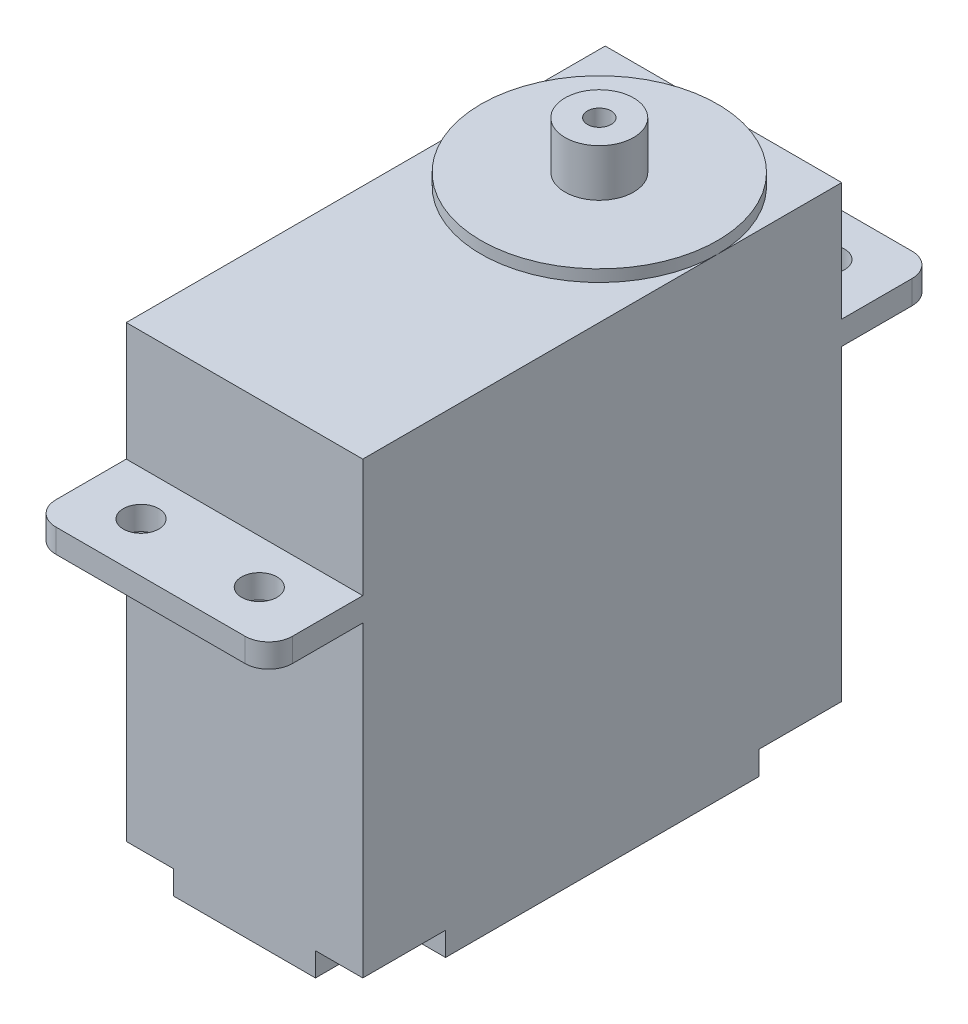
from build123d import *

# Parameters (mm, degrees)
SKETCH2_W           = 20
SKETCH2_H           = 40.5
BOSS_EXTRUDE1_DEPTH = 28
SKETCH3_W           = 20
SKETCH3_H           = 56.4
BOSS_EXTRUDE2_DEPTH = 2
SKETCH4_W           = 20
SKETCH4_H           = 40.5
BOSS_EXTRUDE3_DEPTH = 10
SKETCH5_R           = 10
BOSS_EXTRUDE4_DEPTH = 1
SKETCH6_R           = 2.9
SKETCH6_R_2         = 1
BOSS_EXTRUDE5_DEPTH = 4
SKETCH7_R           = 1.5
CUT_EXTRUDE1_DEPTH  = 2
FILLET1_R           = 2
SKETCH8_W           = 4
SKETCH8_H           = 7
CUT_EXTRUDE2_DEPTH  = 2
SKETCH9_W           = 8
SKETCH9_H           = 3
BOSS_EXTRUDE6_DEPTH = 5


with BuildPart() as part:
    # Sketch2 → Boss-Extrude1 (new body)
    with BuildSketch(Plane(origin=(0, 77, 0), x_dir=(1, 0, 0), z_dir=(0, 1, 0))):
        with Locations((-39.282617367, 276.14521975)):
            Rectangle(SKETCH2_W, SKETCH2_H)
    extrude(amount=BOSS_EXTRUDE1_DEPTH)

    # Sketch3 → Boss-Extrude2 (add)
    with BuildSketch(Plane(origin=(0, 105, 0), x_dir=(1, 0, 0), z_dir=(0, 1, 0))):
        with Locations((-39.282617367, 276.14521975)):
            Rectangle(SKETCH3_W, SKETCH3_H)
    extrude(amount=BOSS_EXTRUDE2_DEPTH)

    # Sketch4 → Boss-Extrude3 (add)
    with BuildSketch(Plane(origin=(0, 107, 0), x_dir=(1, 0, 0), z_dir=(0, 1, 0))):
        with Locations((-39.282617367, 276.14521975)):
            Rectangle(SKETCH4_W, SKETCH4_H)
    extrude(amount=BOSS_EXTRUDE3_DEPTH)

    # Sketch5 → Boss-Extrude4 (add)
    with BuildSketch(Plane(origin=(0, 117, 0), x_dir=(1, 0, 0), z_dir=(0, 1, 0))):
        with Locations((-39.282617367, 285.89521975)):
            Circle(SKETCH5_R)
    extrude(amount=BOSS_EXTRUDE4_DEPTH)

    # Sketch6 → Boss-Extrude5 (add)
    with BuildSketch(Plane(origin=(0, 118, 0), x_dir=(1, 0, 0), z_dir=(0, 1, 0))):
        with Locations((-39.282617367, 285.89521975)):
            Circle(SKETCH6_R)
        with Locations((-39.282617367, 285.89521975)):
            Circle(SKETCH6_R_2, mode=Mode.SUBTRACT)
    extrude(amount=BOSS_EXTRUDE5_DEPTH)

    # Sketch7 → Cut-Extrude1 (cut)
    with BuildSketch(Plane(origin=(0, 107, 0), x_dir=(1, 0, 0), z_dir=(0, 1, 0))):
        with Locations((-44.282617367, 252.14521975)):
            Circle(SKETCH7_R)
        with Locations((-34.282617367, 252.14521975)):
            Circle(SKETCH7_R)
        with Locations((-34.282617367, 300.14521975)):
            Circle(SKETCH7_R)
        with Locations((-44.282617367, 300.14521975)):
            Circle(SKETCH7_R)
    extrude(amount=-CUT_EXTRUDE1_DEPTH, mode=Mode.SUBTRACT)

    # Fillet1
    fillet1_edges = [part.edges().sort_by_distance(p)[0] for p in [
        (-29.282617367, 106, -304.34521975),
        (-49.282617367, 106, -304.34521975),
        (-49.282617367, 106, -247.94521975),
        (-29.282617367, 106, -247.94521975),
    ]]
    fillet(fillet1_edges, radius=FILLET1_R)

    # Sketch8 → Cut-Extrude2 (cut)
    with BuildSketch(Plane.XZ.offset(-77)):
        with Locations((-31.282617367, -259.39521975)):
            Rectangle(SKETCH8_W, SKETCH8_H)
        with Locations((-31.282617367, -292.89521975)):
            Rectangle(SKETCH8_W, SKETCH8_H)
        with Locations((-47.282617367, -292.89521975)):
            Rectangle(SKETCH8_W, SKETCH8_H)
        with Locations((-47.282617367, -259.39521975)):
            Rectangle(SKETCH8_W, SKETCH8_H)
    extrude(amount=-CUT_EXTRUDE2_DEPTH, mode=Mode.SUBTRACT)

    # Sketch9 → Boss-Extrude6 (add)
    with BuildSketch(Plane(origin=(0, 0, -296.39521975), x_dir=(-1, 0, 0), z_dir=(0, 0, -1))):
        with Locations((39.282617367, 78.5)):
            Rectangle(SKETCH9_W, SKETCH9_H)
    extrude(amount=BOSS_EXTRUDE6_DEPTH)


solid = part.part
